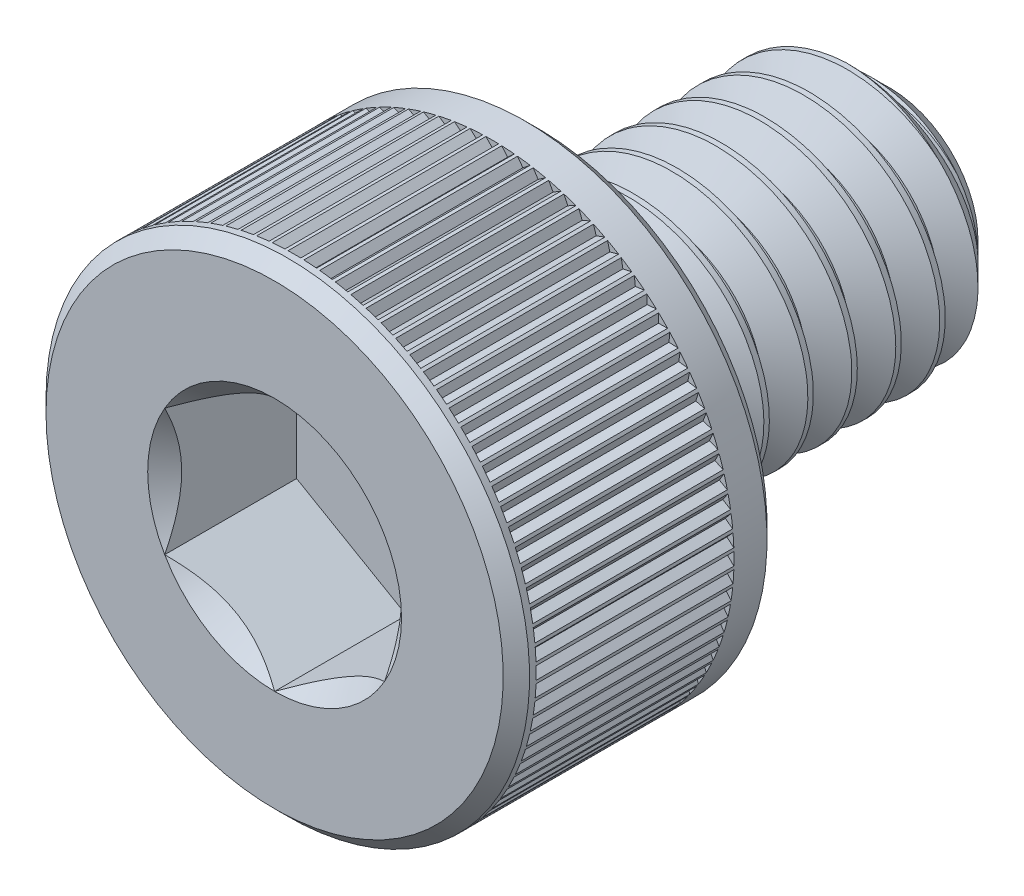
from build123d import *

# Parameters (mm, degrees)
CUT_EXTRUDE1_START = -1.5
CUT_EXTRUDE1_DEPTH = 1.5
SKETCH4_R          = 1.443375673
CUT_EXTRUDE2_DEPTH = 0.5
CUT_EXTRUDE2_DRAFT = -45
CUT_SWEEP1_PITCH   = 0.5
CUT_EXTRUDE4_START = -0.975
CUT_EXTRUDE4_DEPTH = 2.25
CIRPATTERN2_COUNT  = 96


# Read off the part's stored shape, not the designer's step: Split1
with BuildPart() as part:
    # Sketch2 → Revolve1 (revolve)
    with BuildSketch(Plane(origin=(0, 0, 0), x_dir=(0, 0, -1), z_dir=(1, 0, 0)), mode=Mode.PRIVATE) as revolve1_sk:
        Polygon((-3.35, 2.75), (-0.65, 2.75), (-0.5, 2.6), (-0.5, 1.5), (3, 1.5), (3.5, 1), (3.5, 0), (-3.5, 0), (-3.5, 2.6), align=None)
    revolve(revolve1_sk.sketch.rotate(Axis((0, 0, -3.5), (0, 0, 1)), 90), axis=Axis((0, 0, -3.5), (0, 0, 1)))

    # Sketch3 → Cut-Extrude1 (cut)
    with BuildSketch(Plane.XY.offset(3.5).offset(CUT_EXTRUDE1_START)):
        Polygon((0, 1.443375673), (-1.25, 0.721687836), (-1.25, -0.721687836), (0, -1.443375673), (1.25, -0.721687836), (1.25, 0.721687836), align=None)
    extrude(amount=CUT_EXTRUDE1_DEPTH, mode=Mode.SUBTRACT)


with BuildPart() as cut_extrude2_tool:
    # Sketch4 → Cut-Extrude2 (with draft: the straight prism first)
    with BuildSketch(Plane.XY.offset(3.5)):
        Circle(SKETCH4_R)
    extrude(amount=-CUT_EXTRUDE2_DEPTH)
    # Cut-Extrude2: the draft: its side faces are tilted about the plane it starts from
    cut_extrude2_sides = [cut_extrude2_tool.faces().sort_by_distance(p)[0] for p in [
        (-1.443375673, 0, 3.25),
    ]]
    draft(cut_extrude2_sides, Plane.XY.offset(3.5), CUT_EXTRUDE2_DRAFT)


with BuildPart() as part_1:
    add(part.part)

    # Cut-Extrude2: cut by cut_extrude2_tool
    add(cut_extrude2_tool.part, mode=Mode.SUBTRACT)


with BuildPart() as body_2:
    # Split1: the piece on the far side of the plane
    add(part_1.part)
    split(bisect_by=Plane.XY.offset(0.5), keep=Keep.BOTTOM)

    # Cut-Sweep1: the profile of Sketch7 screwed along a right-hand helix of 9 turns, 6 arcs to a turn; built about Z, then put on its axis
    cut_sweep1_z = Axis((0, 0, 0), (0, 0, 1))
    cut_sweep1_corners = [(1.527063294, 0, 0.015625), (1.527063294, 0, -0.453125), (1.175240474, 0, -0.25), (1.175240474, 0, -0.1875)]
    with BuildLine(mode=Mode.PRIVATE) as cut_sweep1_profile:
        Line(cut_sweep1_corners[0], cut_sweep1_corners[1])
        Line(cut_sweep1_corners[1], cut_sweep1_corners[2])
        Line(cut_sweep1_corners[2], cut_sweep1_corners[3])
        Line(cut_sweep1_corners[3], cut_sweep1_corners[0])
    cut_sweep1_cap = Face(cut_sweep1_profile.wire())
    cut_sweep1_turn_angles = [0, 30, 60, 90, 120, 150, 180, 210, 240, 270, 300, 330, 360]
    cut_sweep1_turn_weights = [1, 0.8660254037844387, 1, 0.8660254037844387, 1, 0.8660254037844387, 1, 0.8660254037844387, 1, 0.8660254037844387, 1, 0.8660254037844387, 1]
    cut_sweep1_turn_rails = [Edge.make_bspline([Vector(p[0], p[1], 0).rotate(cut_sweep1_z, cut_sweep1_turn_angles[k]) / cut_sweep1_turn_weights[k] + Vector(0, 0, p[2] + CUT_SWEEP1_PITCH * cut_sweep1_turn_angles[k] / 360) for k in range(13)], [0, 0, 0, 1, 1, 2, 2, 3, 3, 4, 4, 5, 5, 6, 6, 6], 2, cut_sweep1_turn_weights) for p in cut_sweep1_corners]
    cut_sweep1_turn_sides = [Face.make_surface_from_curves(cut_sweep1_turn_rails[p[0]], cut_sweep1_turn_rails[p[1]]) for p in [(0, 1), (1, 2), (2, 3), (3, 0)]]
    cut_sweep1 = Plane(origin=(0, 0, -3.5), x_dir=(0, 1, 0), z_dir=(0, 0, 1)) * Solid(Shell([*[p.moved(Location((0, 0, CUT_SWEEP1_PITCH * i))) for i in range(9) for p in cut_sweep1_turn_sides], cut_sweep1_cap, cut_sweep1_cap.rotate(cut_sweep1_z, 3240).moved(Location((0, 0, CUT_SWEEP1_PITCH * 3240 / 360)))]))
    add(cut_sweep1, mode=Mode.SUBTRACT)


with BuildPart() as part_2:
    add(part_1.part)

    # Split1
    split(bisect_by=Plane.XY.offset(0.5), keep=Keep.TOP)

    add(body_2.part)  # Boss-Extrude1 merges body 2
    # Boss-Extrude1 cone 1 section (through the dimple's axis) → Boss-Extrude1 (revolve)
    with BuildSketch(Plane(origin=(0, 0, 0.5), x_dir=(0, -1, 0), z_dir=(1, 0, 0))):
        Polygon((0, 0), (1.5, 0), (0, 1.5), align=None)
    revolve(axis=Axis((0, 0, 0.5), (0, 0, -1)))

    # Sketch9 → Cut-Extrude4 (cut)
    with BuildSketch(Plane.XY.offset(2).offset(CUT_EXTRUDE4_START)):
        with BuildLine():
            Line((0, 2.674375), (0.071986608, 2.749057644))
            ThreePointArc((0.071986608, 2.749057644), (0, 2.75), (-0.071986608, 2.749057644))
            Line((-0.071986608, 2.749057644), (0, 2.674375))
        make_face()
    cut_extrude4 = extrude(amount=CUT_EXTRUDE4_DEPTH, mode=Mode.SUBTRACT)

    # CirPattern2: Cut-Extrude4 ×96 about axis
    cirpattern2_axis = Axis((0, 0, 0), (0, 0, 1))
    for i in range(1, CIRPATTERN2_COUNT):
        add(cut_extrude4.rotate(cirpattern2_axis, i * 360 / CIRPATTERN2_COUNT), mode=Mode.SUBTRACT)


solid = part_2.part
